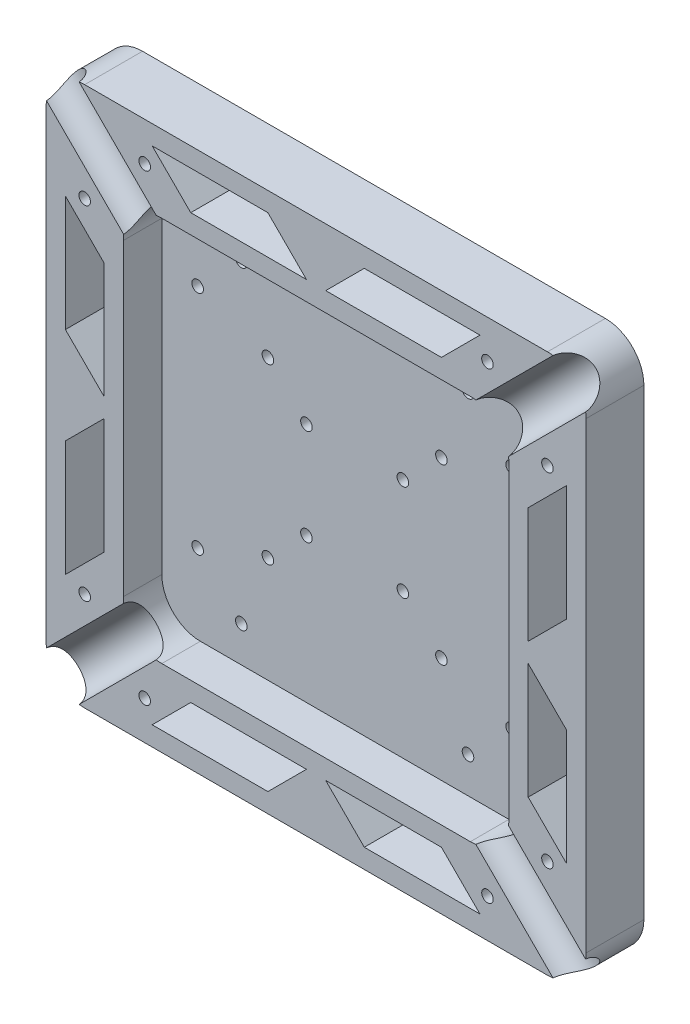
from build123d import *

# Parameters (mm, degrees)
ESQUISSE1_W                  = 140
ESQUISSE1_H                  = 140
BOSS_EXTRU_1_DEPTH           = 15
ESQUISSE4_W                  = 100
ESQUISSE4_H                  = 100
ENL_V_MAT_EXTRU_3_DEPTH      = 10
ENL_V_MAT_EXTRU_1_DEPTH      = 100
R_P_TITION_CIRCULAIRE1_COUNT = 2
R_P_TITION_CIRCULAIRE1_ANGLE = 90
CONG_1_R                     = 10
ESQUISSE3_R                  = 1.5
ENL_V_MAT_EXTRU_2_DEPTH      = 15
ESQUISSE5_R                  = 1.5
ENL_V_MAT_EXTRU_4_DEPTH      = 5


with BuildPart() as part:
    # Esquisse1 → Boss.-Extru.1 (new body)
    with BuildSketch(Plane.XY):
        Rectangle(ESQUISSE1_W, ESQUISSE1_H)
        Polygon((65, 12.5), (55, 2.5), (55, 32.5), (65, 42.5), align=None, mode=Mode.SUBTRACT)
        Polygon((65, -12.5), (55, -2.5), (55, -32.5), (65, -42.5), align=None, mode=Mode.SUBTRACT)
        Polygon((12.5, -65), (2.5, -55), (32.5, -55), (42.5, -65), align=None, mode=Mode.SUBTRACT)
        Polygon((-12.5, -65), (-2.5, -55), (-32.5, -55), (-42.5, -65), align=None, mode=Mode.SUBTRACT)
        Polygon((-65, -12.5), (-55, -2.5), (-55, -32.5), (-65, -42.5), align=None, mode=Mode.SUBTRACT)
        Polygon((-65, 12.5), (-55, 2.5), (-55, 32.5), (-65, 42.5), align=None, mode=Mode.SUBTRACT)
        Polygon((-12.5, 65), (-2.5, 55), (-32.5, 55), (-42.5, 65), align=None, mode=Mode.SUBTRACT)
        Polygon((12.5, 65), (2.5, 55), (32.5, 55), (42.5, 65), align=None, mode=Mode.SUBTRACT)
    extrude(amount=BOSS_EXTRU_1_DEPTH)

    # Esquisse4 → Enlèv. mat.-Extru.3 (cut)
    with BuildSketch(Plane.XY.offset(15)):
        Rectangle(ESQUISSE4_W, ESQUISSE4_H)
    extrude(amount=-ENL_V_MAT_EXTRU_3_DEPTH, mode=Mode.SUBTRACT)

    # Esquisse2 → Enlèv. mat.-Extru.1 (cut, symmetric)
    with BuildSketch(Plane(origin=(0, 0, 0), x_dir=(-0.7071067811865475, -0.7071067811865477, 0), z_dir=(-0.7071067811865477, 0.7071067811865475, 0))):
        with BuildLine():
            Line((-6, 15.5), (6, 15.5))
            ThreePointArc((6, 15.5), (0, 9.5), (-6, 15.5))
        make_face()
    enl_v_mat_extru_1 = extrude(amount=ENL_V_MAT_EXTRU_1_DEPTH, both=True, mode=Mode.SUBTRACT)

    # Répétition circulaire1: Enlèv. mat.-Extru.1 ×2 about axis
    r_p_tition_circulaire1_axis = Axis((0, 0, -62.841973852), (0, 0, 1))
    for i in range(1, R_P_TITION_CIRCULAIRE1_COUNT):
        add(enl_v_mat_extru_1.rotate(r_p_tition_circulaire1_axis, i * R_P_TITION_CIRCULAIRE1_ANGLE / (R_P_TITION_CIRCULAIRE1_COUNT - 1)), mode=Mode.SUBTRACT)

    # Congé1
    cong_1_edges = [part.edges().sort_by_distance(p)[0] for p in [
        (50, -50, 7.25),
        (-50, -50, 7.25),
        (50, 50, 7.25),
        (-50, 50, 7.25),
    ]]
    fillet(cong_1_edges, radius=CONG_1_R)
    cong_1_2_edges = [part.edges().sort_by_distance(p)[0] for p in [
        (-70, 70, 4.75),
        (-70, -70, 4.75),
        (70, 70, 4.75),
        (70, -70, 4.75),
    ]]
    fillet(cong_1_2_edges, radius=CONG_1_R)

    # Esquisse3 → Enlèv. mat.-Extru.2 (cut)
    with BuildSketch(Plane.XY.offset(15)):
        with Locations((-60, -44.443650814)):
            Circle(ESQUISSE3_R)
        with Locations((-44.443650814, -60)):
            Circle(ESQUISSE3_R)
        with Locations((-44.443650814, 60)):
            Circle(ESQUISSE3_R)
        with Locations((-60, 44.443650814)):
            Circle(ESQUISSE3_R)
        with Locations((60, 44.443650814)):
            Circle(ESQUISSE3_R)
        with Locations((44.443650814, 60)):
            Circle(ESQUISSE3_R)
        with Locations((44.443650814, -60)):
            Circle(ESQUISSE3_R)
        with Locations((60, -44.443650814)):
            Circle(ESQUISSE3_R)
    extrude(amount=-ENL_V_MAT_EXTRU_2_DEPTH, mode=Mode.SUBTRACT)

    # Esquisse5 → Enlèv. mat.-Extru.4 (cut)
    with BuildSketch(Plane.XY.offset(5)):
        with Locations((-22.5, 22.5)):
            Circle(ESQUISSE5_R)
        with Locations((22.499999975, 22.498488866)):
            Circle(ESQUISSE5_R)
        with Locations((-22.500000025, -22.5)):
            Circle(ESQUISSE5_R)
        with Locations((22.499999975, -22.501511134)):
            Circle(ESQUISSE5_R)
        with Locations((-12.5, 12.5)):
            Circle(ESQUISSE5_R)
        with Locations((12.5, 12.5)):
            Circle(ESQUISSE5_R)
        with Locations((12.5, -12.5)):
            Circle(ESQUISSE5_R)
        with Locations((-12.5, -12.5)):
            Circle(ESQUISSE5_R)
        with Locations((29.393398282, 40.707106781)):
            Circle(ESQUISSE5_R)
        with Locations((40.707106781, 29.393398282)):
            Circle(ESQUISSE5_R)
        with Locations((40.707106781, -29.393398282)):
            Circle(ESQUISSE5_R)
        with Locations((29.393398282, -40.707106781)):
            Circle(ESQUISSE5_R)
        with Locations((-29.393398282, -40.707106781)):
            Circle(ESQUISSE5_R)
        with Locations((-40.707106781, -29.393398282)):
            Circle(ESQUISSE5_R)
        with Locations((-40.707106781, 29.393398282)):
            Circle(ESQUISSE5_R)
        with Locations((-29.393398282, 40.707106781)):
            Circle(ESQUISSE5_R)
    extrude(amount=-ENL_V_MAT_EXTRU_4_DEPTH, mode=Mode.SUBTRACT)


solid = part.part
